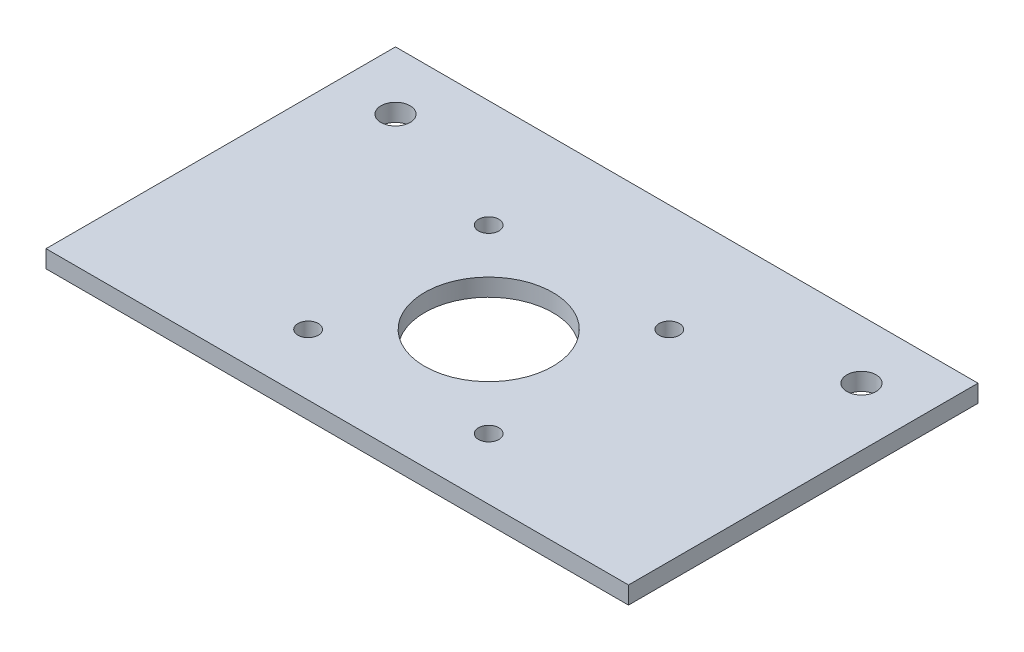
from build123d import *

# Parameters (mm, degrees)
SKETCH1_W          = 100
SKETCH1_H          = 60
BASE_FLANGE1_DEPTH = 3
SKETCH6_R          = 2.5
SKETCH6_R_2        = 11
SKETCH6_R_3        = 1.75
CUT_EXTRUDE1_DEPTH = 10


# Sheet-metal steps are written as plain solids
with BuildPart() as part:
    # Sketch1 → Base-Flange1 (new body)
    with BuildSketch(Plane(origin=(0, 0, 0), x_dir=(1, 0, 0), z_dir=(0, 1, 0))):
        Rectangle(SKETCH1_W, SKETCH1_H)
    extrude(amount=-BASE_FLANGE1_DEPTH)

    # Sketch6 → Cut-Extrude1 (cut)
    with BuildSketch(Plane(origin=(0, 0, 0), x_dir=(1, 0, 0), z_dir=(0, 1, 0))):
        with Locations(Location((40, 20, 0), (0, 0, 270))):
            Circle(SKETCH6_R)
        with Locations(Location((-40, 20, 0), (0, 0, 90))):
            Circle(SKETCH6_R)
        with Locations(Location((0, -4, 0), (0, 0, 270))):
            Circle(SKETCH6_R_2)
        with Locations(Location((15.5, 11.5, 0), (0, 0, 270))):
            Circle(SKETCH6_R_3)
        with Locations(Location((15.5, -19.5, 0), (0, 0, 90))):
            Circle(SKETCH6_R_3)
        with Locations(Location((-15.5, -19.5, 0), (0, 0, 270))):
            Circle(SKETCH6_R_3)
        with Locations(Location((-15.5, 11.5, 0), (0, 0, 90))):
            Circle(SKETCH6_R_3)
    extrude(amount=-CUT_EXTRUDE1_DEPTH, mode=Mode.SUBTRACT)


solid = part.part
